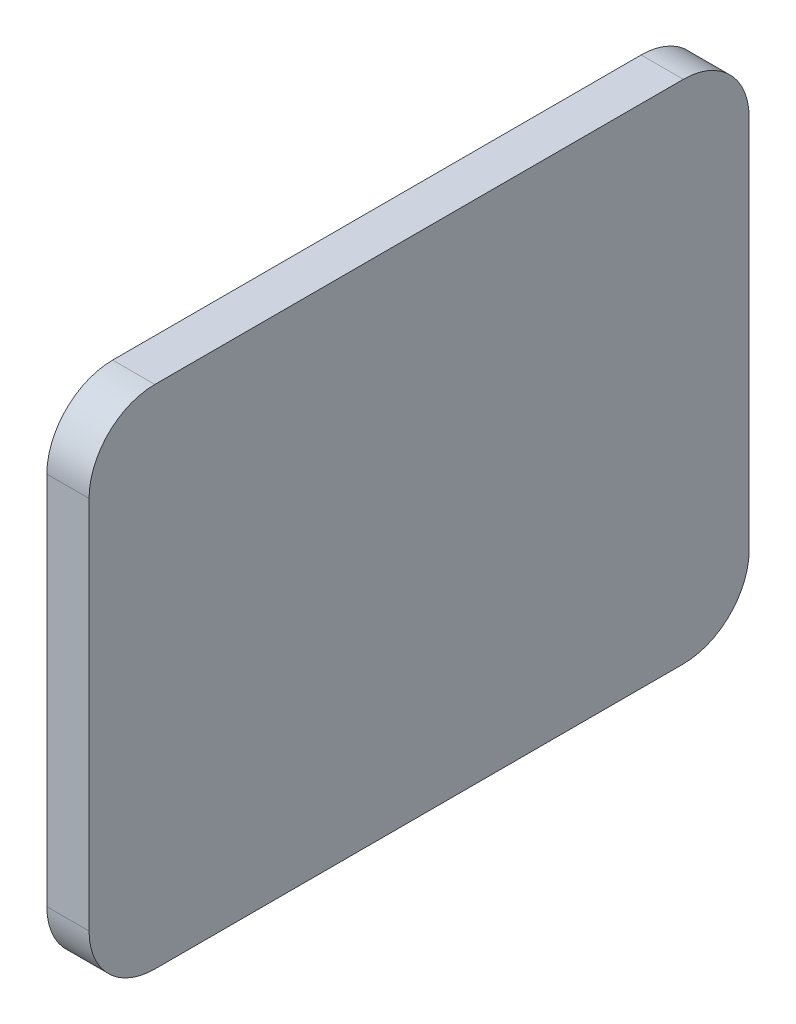
from build123d import *

# Parameters (mm, degrees)
BOSS_EXTRUDE1_DEPTH = 2.54


with BuildPart() as part:
    # Sketch1 → Boss-Extrude1 (new body)
    with BuildSketch(Plane.ZY.offset(-38.1)):
        with BuildLine():
            Line((9.09520748, 15.24), (40.91104252, 15.24))
            ThreePointArc((40.91104252, 15.24), (43.712882429, 14.07943991), (44.87344252, 11.2776))
            Line((44.87344252, 11.2776), (44.87344252, -11.2776))
            ThreePointArc((44.87344252, -11.2776), (43.712882429, -14.07943991), (40.91104252, -15.24))
            Line((40.91104252, -15.24), (9.09520748, -15.24))
            ThreePointArc((9.09520748, -15.24), (6.293367571, -14.07943991), (5.13280748, -11.2776))
            Line((5.13280748, -11.2776), (5.13280748, 11.2776))
            ThreePointArc((5.13280748, 11.2776), (6.293367571, 14.07943991), (9.09520748, 15.24))
        make_face()
    extrude(amount=BOSS_EXTRUDE1_DEPTH)


solid = part.part
